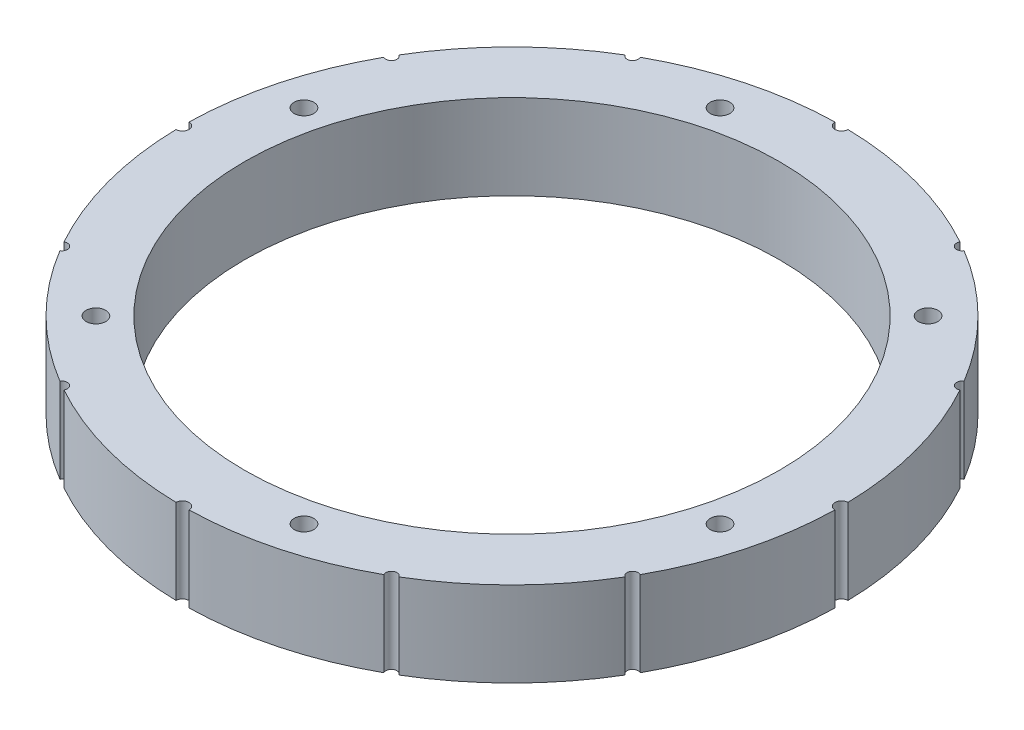
from build123d import *

# Parameters (mm, degrees)
SKETCH_1_R               = 50.4
SKETCH_1_R_2             = 40.9
EXTRUDE_1_DEPTH          = 13
SKETCH_2_R               = 1
SKETCH_2_R_2             = 0.85
CUT_EXTRUDE_1_DEPTH      = 13
SKETCH_3_R               = 1.5
CUT_EXTRUDE_2_DEPTH      = 5
PATTERN_CIRCULAR_1_COUNT = 6


with BuildPart() as part:
    # 草图1 → 凸台-拉伸1 (new body)
    with BuildSketch(Plane(origin=(0, 0, 0), x_dir=(1, 0, 0), z_dir=(0, 1, 0))):
        Circle(SKETCH_1_R)
        Circle(SKETCH_1_R_2, mode=Mode.SUBTRACT)
    extrude(amount=-EXTRUDE_1_DEPTH)

    # 草图2 → 切除-拉伸1 (cut)
    with BuildSketch(Plane.XZ.offset(13)):
        with Locations((0, 50.4)):
            Circle(SKETCH_2_R)
        with Locations((50.4, 0)):
            Circle(SKETCH_2_R)
        with Locations((0, -50.4)):
            Circle(SKETCH_2_R)
        with Locations((-50.4, 0)):
            Circle(SKETCH_2_R)
        with Locations((-25.2, 43.647680351)):
            Circle(SKETCH_2_R_2)
        with Locations((25.2, 43.647680351)):
            Circle(SKETCH_2_R_2)
        with Locations((43.647680351, 25.2)):
            Circle(SKETCH_2_R_2)
        with Locations((43.647680351, -25.2)):
            Circle(SKETCH_2_R_2)
        with Locations((25.2, -43.647680351)):
            Circle(SKETCH_2_R_2)
        with Locations((-25.2, -43.647680351)):
            Circle(SKETCH_2_R_2)
        with Locations((-43.647680351, -25.2)):
            Circle(SKETCH_2_R_2)
        with Locations((-43.647680351, 25.2)):
            Circle(SKETCH_2_R_2)
    extrude(amount=-CUT_EXTRUDE_1_DEPTH, mode=Mode.SUBTRACT)

    # 草图3 → 切除-拉伸2 (cut)
    with BuildSketch(Plane(origin=(0, 0, 0), x_dir=(1, 0, 0), z_dir=(0, 1, 0))):
        with Locations((-11.64685703, 43.466662183)):
            Circle(SKETCH_3_R)
    cut_extrude_2 = extrude(amount=-CUT_EXTRUDE_2_DEPTH, mode=Mode.SUBTRACT)

    # 阵列(圆周)1: 切除-拉伸2 ×6 about axis
    pattern_circular_1_axis = Axis((0, 10.291438893, 0), (0, -1, 0))
    for i in range(1, PATTERN_CIRCULAR_1_COUNT):
        add(cut_extrude_2.rotate(pattern_circular_1_axis, i * 360 / PATTERN_CIRCULAR_1_COUNT), mode=Mode.SUBTRACT)


solid = part.part
